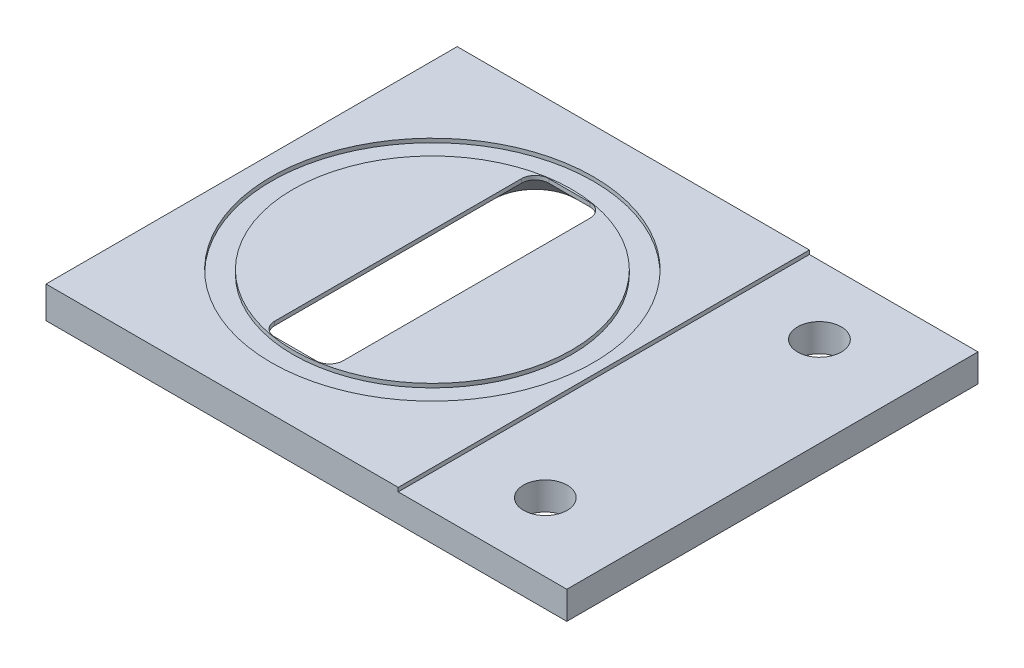
from build123d import *

# Parameters (mm, degrees)
SKETCH2_W           = 38
SKETCH2_H           = 30
BOSS_EXTRUDE1_DEPTH = 2.032
CUT_EXTRUDE4_DEPTH  = 30.064001304
CUT_EXTRUDE4_DRAFT  = 45
SKETCH5_R           = 1.595
CUT_EXTRUDE5_DEPTH  = 30.064001304
SKETCH6_W           = 25.7
SKETCH6_H           = 30
SKETCH6_R           = 11.75
SKETCH6_R_2         = 10.1625
BOSS_EXTRUDE4_DEPTH = 0.2874


with BuildPart() as part:
    # Sketch2 → Boss-Extrude1 (new body)
    with BuildSketch(Plane(origin=(0, 0, 0), x_dir=(1, 0, 0), z_dir=(0, 1, 0))):
        with Locations((5.811028754, 0)):
            Rectangle(SKETCH2_W, SKETCH2_H)
    extrude(amount=BOSS_EXTRUDE1_DEPTH)


with BuildPart() as cut_extrude4_tool:
    # Sketch4 → Cut-Extrude4 (with draft: the straight prism first)
    with BuildSketch(Plane(origin=(0, 2.032, 0), x_dir=(1, 0, 0), z_dir=(0, 1, 0))):
        with BuildLine():
            ThreePointArc((1.5, -10), (2.207106781, -9.707106781), (2.5, -9))
            Line((2.5, -9), (2.5, 9))
            ThreePointArc((2.5, 9), (2.207106781, 9.707106781), (1.5, 10))
            Line((1.5, 10), (-1.5, 10))
            ThreePointArc((-1.5, 10), (-2.207106781, 9.707106781), (-2.5, 9))
            Line((-2.5, 9), (-2.5, -9))
            ThreePointArc((-2.5, -9), (-2.207106781, -9.707106781), (-1.5, -10))
            Line((-1.5, -10), (1.5, -10))
        make_face()
    extrude(amount=-CUT_EXTRUDE4_DEPTH)
    # Cut-Extrude4: the draft: its side faces are tilted about the plane it starts from
    cut_extrude4_sides = [cut_extrude4_tool.faces().sort_by_distance(p)[0] for p in [
        (-2.207106781, -13.000000652, 9.707106781),
        (0, -13.000000652, 10),
        (2.207106781, -13.000000652, 9.707106781),
        (2.5, -13.000000652, 0),
        (2.207106781, -13.000000652, -9.707106781),
        (0, -13.000000652, -10),
        (-2.207106781, -13.000000652, -9.707106781),
        (-2.5, -13.000000652, 0),
    ]]
    draft(cut_extrude4_sides, Plane(origin=(0, 2.032, 0), x_dir=(1, 0, 0), z_dir=(0, 1, 0)), CUT_EXTRUDE4_DRAFT)


with BuildPart() as part_1:
    add(part.part)

    # Cut-Extrude4: cut by cut_extrude4_tool
    add(cut_extrude4_tool.part, mode=Mode.SUBTRACT)

    # Sketch5 → Cut-Extrude5 (cut, through all)
    with BuildSketch(Plane(origin=(0, 2.032, 0), x_dir=(1, 0, 0), z_dir=(0, 1, 0))):
        with Locations((18.242707696, -10)):
            Circle(SKETCH5_R)
        with Locations((18.242707696, 10)):
            Circle(SKETCH5_R)
    extrude(amount=-CUT_EXTRUDE5_DEPTH, mode=Mode.SUBTRACT)

    # Sketch6 → Boss-Extrude4 (add)
    # profile 1 of 2: a face of its own
    with BuildSketch(Plane(origin=(0, 2.032, 0), x_dir=(1, 0, 0), z_dir=(0, 1, 0))):
        with Locations((-0.338971246, 0)):
            Rectangle(SKETCH6_W, SKETCH6_H)
        Circle(SKETCH6_R, mode=Mode.SUBTRACT)
    # profile 2 of 2: a face of its own
    with BuildSketch(Plane(origin=(0, 2.032, 0), x_dir=(1, 0, 0), z_dir=(0, 1, 0))):
        Circle(SKETCH6_R_2)
        with BuildLine():
            Line((1.5, -10), (-1.5, -10))
            ThreePointArc((-1.5, -10), (-2.207106781, -9.707106781), (-2.5, -9))
            Line((-2.5, -9), (-2.5, 9))
            ThreePointArc((-2.5, 9), (-2.207106781, 9.707106781), (-1.5, 10))
            Line((-1.5, 10), (1.5, 10))
            ThreePointArc((1.5, 10), (2.207106781, 9.707106781), (2.5, 9))
            Line((2.5, 9), (2.5, -9))
            ThreePointArc((2.5, -9), (2.207106781, -9.707106781), (1.5, -10))
        make_face(mode=Mode.SUBTRACT)
    extrude(amount=BOSS_EXTRUDE4_DEPTH)


solid = part_1.part
